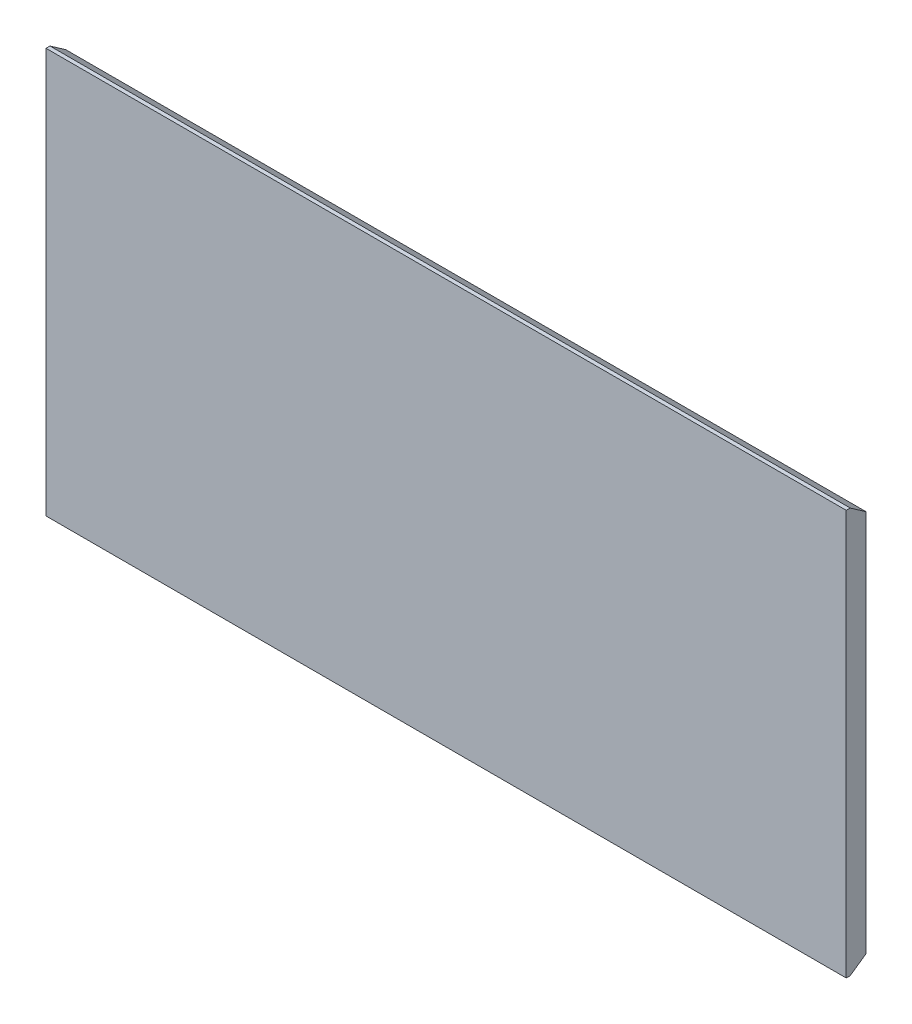
from build123d import *

# Parameters (mm, degrees)
SKETCH_1_W             = 405
SKETCH_1_H             = 205
SM_BASE_FLANGE_1_DEPTH = 10
CHAMFER_1_SIZE         = 8
CHAMFER_1_SIZE2        = 5.601660306
CHAMFER_2_SIZE         = 8
CHAMFER_2_SIZE2        = 5.601660306


# Sheet-metal steps are written as plain solids
with BuildPart() as part:
    # Sketch 1 → 基体-法兰1 (new body)
    with BuildSketch(Plane.XY):
        Rectangle(SKETCH_1_W, SKETCH_1_H)
    extrude(amount=-SM_BASE_FLANGE_1_DEPTH)

    # 倒角1
    chamfer_1_edges = [part.edges().sort_by_distance(p)[0] for p in [
        (0, 102.5, -10),
    ]]
    chamfer_1_side = [part.faces().sort_by_distance(p)[0] for p in [
        (0, 102.5, -5),
    ]]
    chamfer(chamfer_1_edges, length=CHAMFER_1_SIZE, length2=CHAMFER_1_SIZE2, reference=chamfer_1_side[0])

    # 倒角2
    chamfer_2_edges = [part.edges().sort_by_distance(p)[0] for p in [
        (0, -102.5, -10),
    ]]
    chamfer_2_side = [part.faces().sort_by_distance(p)[0] for p in [
        (0, -102.5, -5),
    ]]
    chamfer(chamfer_2_edges, length=CHAMFER_2_SIZE, length2=CHAMFER_2_SIZE2, reference=chamfer_2_side[0])


solid = part.part
